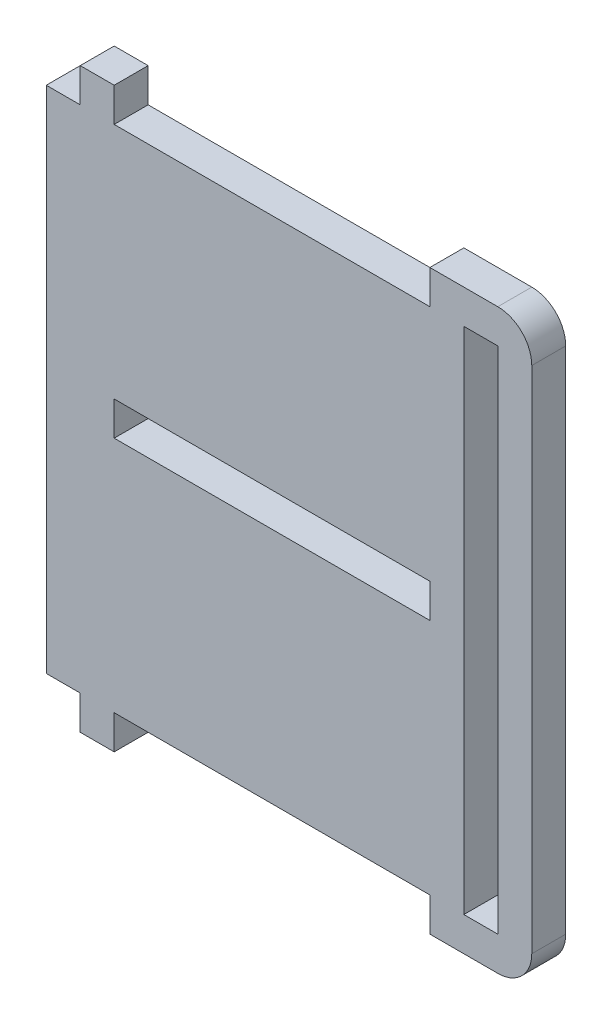
from build123d import *

# Parameters (mm, degrees)
SKETCH1_W           = 59.0248375
SKETCH1_H           = 6.35
SKETCH1_W_2         = 6.35
SKETCH1_H_2         = 95.25
BOSS_EXTRUDE1_DEPTH = 6.35


with BuildPart() as part:
    # Sketch1 → Boss-Extrude1 (new body)
    with BuildSketch(Plane.XY):
        with BuildLine():
            Line((-36.4109, 0), (-30.0609, 0))
            Line((-30.0609, 0), (-30.0609, 6.35))
            Line((-30.0609, 6.35), (28.9639375, 6.35))
            Line((28.9639375, 6.35), (28.9639375, 0))
            Line((28.9639375, 0), (41.6639375, 0))
            ThreePointArc((41.6639375, 0), (46.154065561, 1.859871939), (48.0139375, 6.35))
            Line((48.0139375, 6.35), (48.0139375, 101.6))
            ThreePointArc((48.0139375, 101.6), (46.154065561, 106.090128061), (41.6639375, 107.95))
            Line((41.6639375, 107.95), (28.9639375, 107.95))
            Line((28.9639375, 107.95), (28.9639375, 101.6))
            Line((28.9639375, 101.6), (-30.0609, 101.6))
            Line((-30.0609, 101.6), (-30.0609, 107.95))
            Line((-30.0609, 107.95), (-36.4109, 107.95))
            Line((-36.4109, 107.95), (-36.4109, 101.6))
            Line((-36.4109, 101.6), (-42.7609, 101.6))
            Line((-42.7609, 101.6), (-42.7609, 6.35))
            Line((-42.7609, 6.35), (-36.4109, 6.35))
            Line((-36.4109, 6.35), (-36.4109, 0))
        make_face()
        with Locations((-0.54848125, 53.975)):
            Rectangle(SKETCH1_W, SKETCH1_H, mode=Mode.SUBTRACT)
        with Locations((38.4889375, 53.975)):
            Rectangle(SKETCH1_W_2, SKETCH1_H_2, mode=Mode.SUBTRACT)
    extrude(amount=BOSS_EXTRUDE1_DEPTH)


solid = part.part
